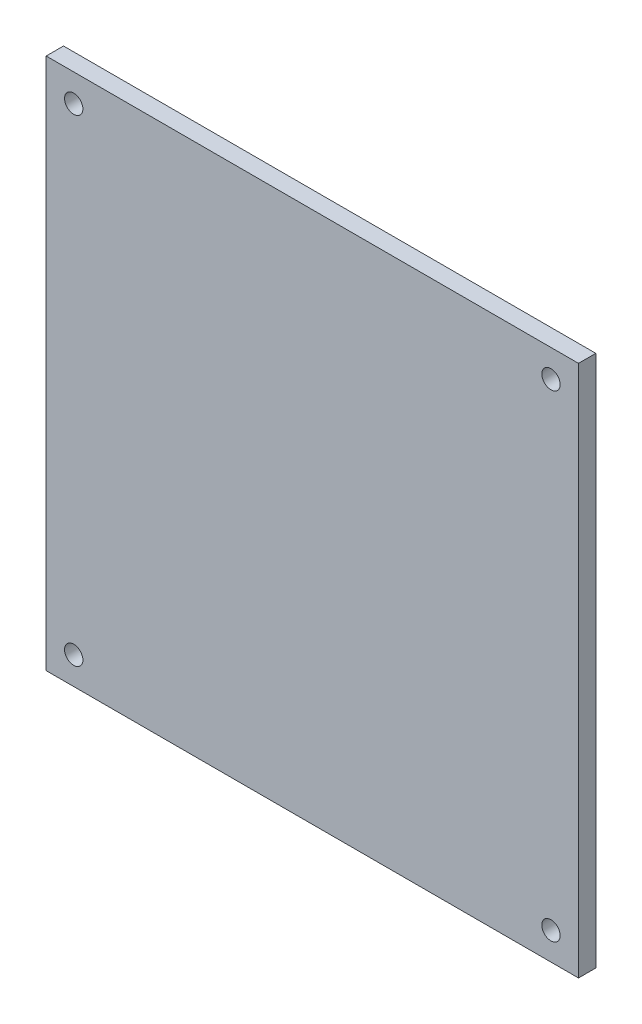
from build123d import *

# Parameters (mm, degrees)
SKETCH1_W           = 184.15
SKETCH1_H           = 184.15
SKETCH1_R           = 3.175
BOSS_EXTRUDE1_DEPTH = 5.9944


with BuildPart() as part:
    # Sketch1 → Boss-Extrude1 (new body)
    with BuildSketch(Plane.XY):
        with Locations((92.075, 92.075)):
            Rectangle(SKETCH1_W, SKETCH1_H)
        with Locations((9.525, 174.625)):
            Circle(SKETCH1_R, mode=Mode.SUBTRACT)
        with Locations((9.525, 9.525)):
            Circle(SKETCH1_R, mode=Mode.SUBTRACT)
        with Locations((174.625, 174.625)):
            Circle(SKETCH1_R, mode=Mode.SUBTRACT)
        with Locations((174.625, 9.525)):
            Circle(SKETCH1_R, mode=Mode.SUBTRACT)
    extrude(amount=BOSS_EXTRUDE1_DEPTH)


solid = part.part
